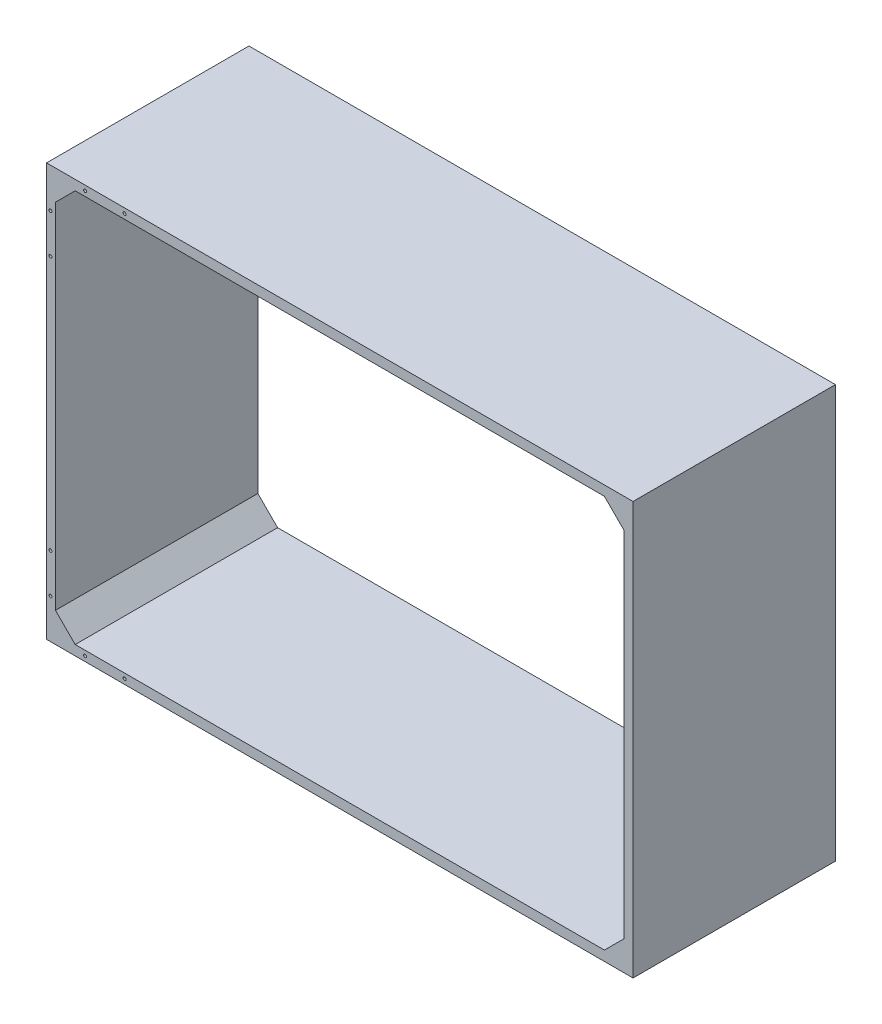
from build123d import *

# Parameters (mm, degrees)
SKETCH_1_W                = 594
SKETCH_1_H                = 418
EXTRUDE_1_DEPTH           = 205
SKETCH_2_W                = 576
SKETCH_2_H                = 398
CUT_EXTRUDE_1_DEPTH       = 418.031173895
HOLE_WIZARD_3_0_3_1_D     = 3
HOLE_WIZARD_3_0_3_1_DEPTH = 14.098709071
HOLE_WIZARD_3_0_3_1_TIP   = 0.901290929
CHAMFER_1_SIZE            = 20


with BuildPart() as part:
    # Эскиз1 → Бобышка-Вытянуть1 (new body)
    with BuildSketch(Plane(origin=(0, 0, -205), x_dir=(-1, 0, 0), z_dir=(0, 0, -1))):
        Rectangle(SKETCH_1_W, SKETCH_1_H)
    extrude(amount=-EXTRUDE_1_DEPTH)

    # Эскиз2 → Вырез-Вытянуть1 (cut, through all)
    with BuildSketch(Plane.XY):
        Rectangle(SKETCH_2_W, SKETCH_2_H)
    extrude(amount=-CUT_EXTRUDE_1_DEPTH, mode=Mode.SUBTRACT)

    # Диаметр отверстия Ø3.0 (3)1
    with Locations(Plane.XY):
        with Locations((-293, -169), (-293, -129), (-258, 204), (-293, 169), (-293, 129), (-218, 204), (-258, -204), (-218, -204)):
            Hole(HOLE_WIZARD_3_0_3_1_D / 2, depth=HOLE_WIZARD_3_0_3_1_DEPTH)
            with Locations((0, 0, -(HOLE_WIZARD_3_0_3_1_DEPTH + HOLE_WIZARD_3_0_3_1_TIP / 2))):  # 118° drill point
                Cone(0, HOLE_WIZARD_3_0_3_1_D / 2, HOLE_WIZARD_3_0_3_1_TIP, mode=Mode.SUBTRACT)

    # Фаска1
    chamfer_1_edges = [part.edges().sort_by_distance(p)[0] for p in [
        (288, -199, -102.5),
        (288, 199, -102.5),
        (-288, -199, -102.5),
        (-288, 199, -102.5),
    ]]
    chamfer(chamfer_1_edges, length=CHAMFER_1_SIZE)


solid = part.part
